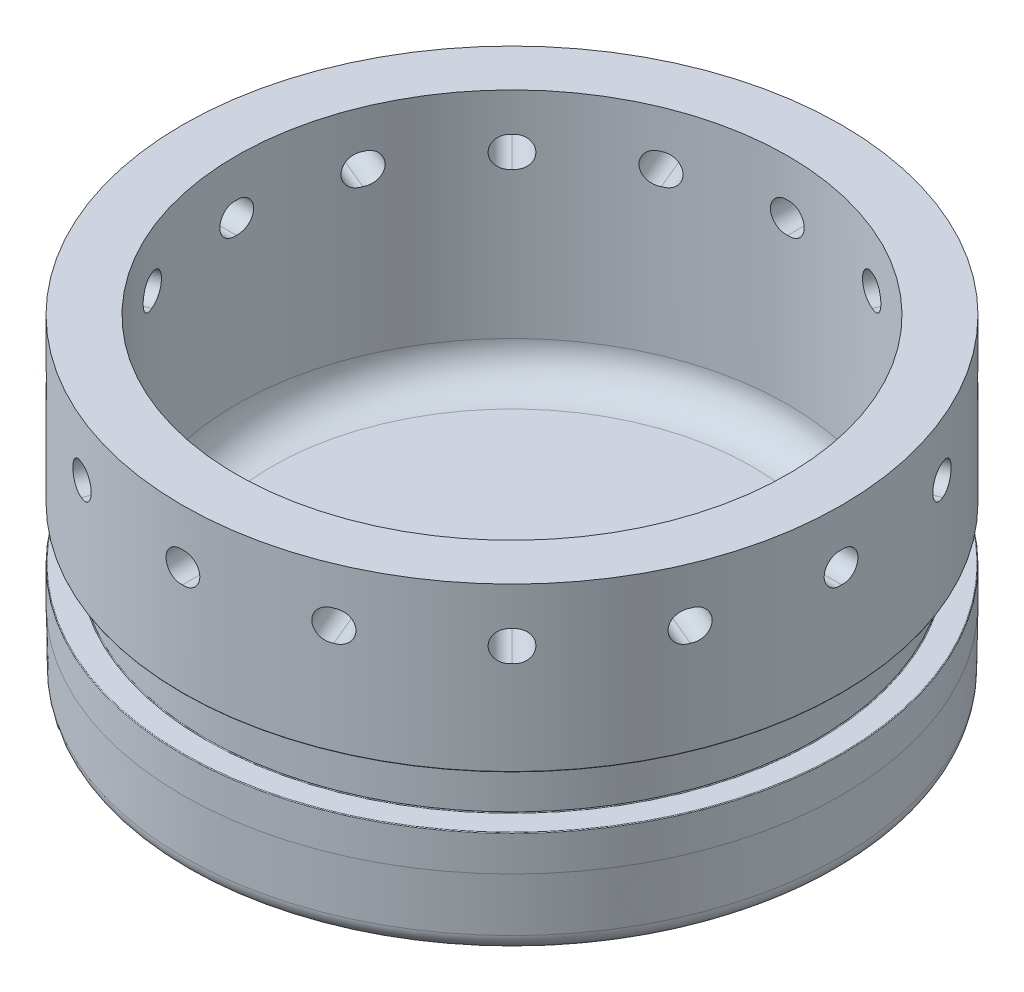
from build123d import *

# Parameters (mm, degrees)
FORWARDCLOSUREHOLES_D = 5.4102
HOLEPATTERN_COUNT     = 16
POCKETFILLET_R        = 6.35
TAPERFILLET_R         = 3.175
FILLET3_R             = 0.127


with BuildPart() as part:
    # Sketch1 → Revolve1 (revolve)
    with BuildSketch(Plane.XY):
        Polygon((0, 3.175), (0.221679325, -9.525), (58.4454, -9.525), (58.4454, 3.175), (9.525, 3.175), (9.525, 47.7012), (0, 47.7012), (0, 18.796), (4.318, 18.796), (4.318, 9.525), (0, 9.525), align=None)
    revolve(axis=Axis((58.4454, -9.525, 0), (0, 1, 0)))

    # ForwardClosureHoles (through all)
    with Locations(Plane.XY.offset(58.4454)):
        with Locations((58.7375, 38.1762)):
            forwardclosureholes = Hole(FORWARDCLOSUREHOLES_D / 2)

    # HolePattern: ForwardClosureHoles ×16 about axis
    holepattern_axis = Axis((58.4454, 47.7012, 0), (0, -1, 0))
    for i in range(1, HOLEPATTERN_COUNT):
        add(forwardclosureholes.rotate(holepattern_axis, i * 360 / HOLEPATTERN_COUNT), mode=Mode.SUBTRACT)

    # PocketFillet
    pocketfillet_edges = [part.edges().sort_by_distance(p)[0] for p in [
        (107.3658, 3.175, 0),
    ]]
    fillet(pocketfillet_edges, radius=POCKETFILLET_R)

    # TaperFillet
    taperfillet_edges = [part.edges().sort_by_distance(p)[0] for p in [
        (116.669120675, -9.525, 0),
    ]]
    fillet(taperfillet_edges, radius=TAPERFILLET_R)

    # Fillet3
    fillet3_edges = [part.edges().sort_by_distance(p)[0] for p in [
        (116.8908, 9.525, 0),
        (112.5728, 9.525, 0),
        (112.5728, 18.796, 0),
        (116.8908, 18.796, 0),
    ]]
    fillet(fillet3_edges, radius=FILLET3_R)


solid = part.part
